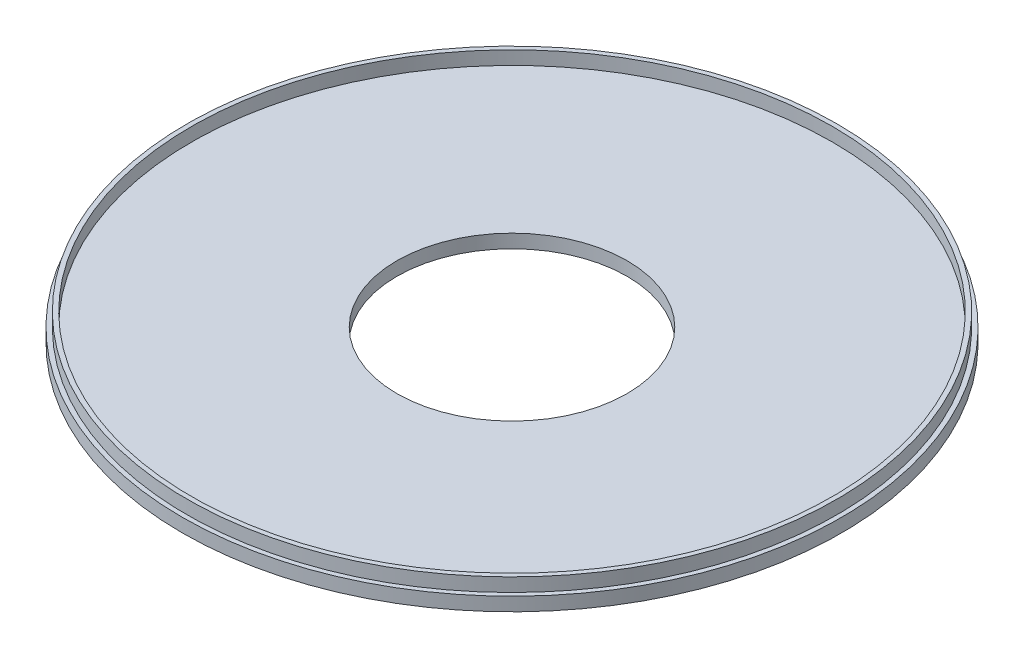
from build123d import *


with BuildPart() as part:
    # Schizzo1 → Rivoluzione1 (revolve)
    with BuildSketch(Plane.XY):
        Polygon((-25.5, 0), (-25.5, 3), (-71, 3), (-71, 6), (-72, 6), (-72, 3), (-73, 3), (-73, 0), align=None)
    revolve(axis=Axis((0, 0, 0), (0, 1, 0)))


solid = part.part
